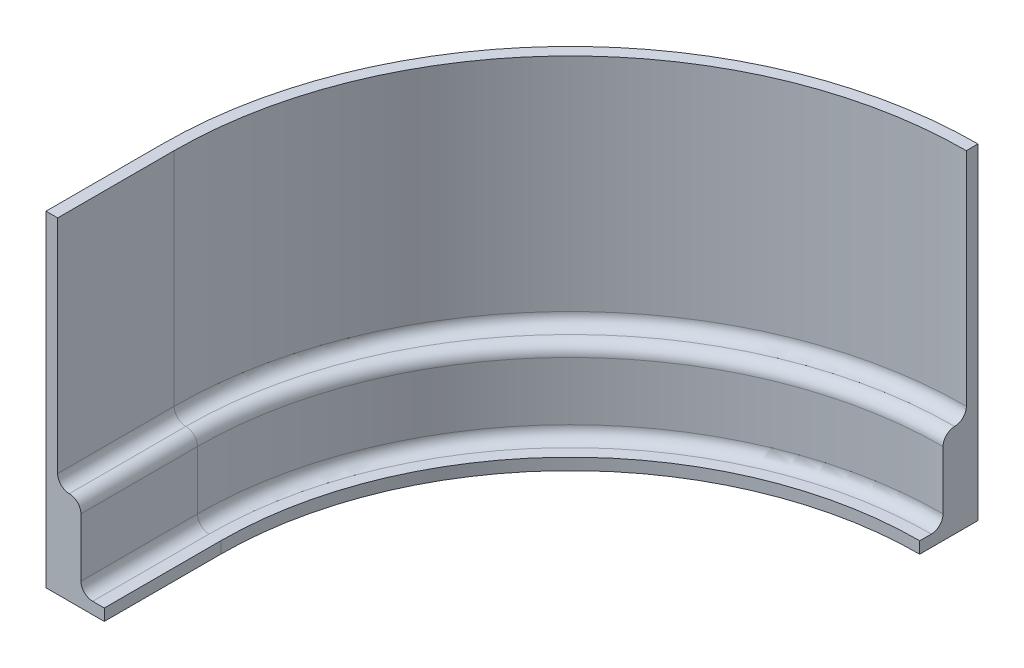
from build123d import *

# Parameters (mm, degrees)
BOTTOM_LEVEL_DEPTH = 5
MID_LEVEL_DEPTH    = 35
GUARD_RAIL_DEPTH   = 100
ROUNDING_R         = 5


with BuildPart() as part:
    # Sketch1 → Bottom level (new body)
    with BuildSketch(Plane(origin=(0, 0, 0), x_dir=(1, 0, 0), z_dir=(0, 1, 0))):
        with BuildLine():
            Line((150, 150), (150, 175))
            ThreePointArc((150, 175), (26.256313292, 123.743686708), (-25, 0))
            Line((-25, 0), (-25, -50))
            Line((-25, -50), (0, -50))
            Line((0, -50), (0, 0))
            ThreePointArc((0, 0), (43.933982822, 106.066017178), (150, 150))
        make_face()
    extrude(amount=BOTTOM_LEVEL_DEPTH)

    # Sketch2 → Mid level (add)
    with BuildSketch(Plane(origin=(0, 5, 0), x_dir=(1, 0, 0), z_dir=(0, 1, 0))):
        with BuildLine():
            Line((-25, 0), (-25, -50))
            Line((-25, -50), (-10, -50))
            Line((-10, -50), (-10, 0))
            ThreePointArc((-10, 0), (36.86291501, 113.13708499), (150, 160))
            Line((150, 160), (150, 175))
            ThreePointArc((150, 175), (26.256313292, 123.743686708), (-25, 0))
        make_face()
    extrude(amount=MID_LEVEL_DEPTH)

    # Sketch3 → Guard rail (add)
    with BuildSketch(Plane(origin=(0, 40, 0), x_dir=(1, 0, 0), z_dir=(0, 1, 0))):
        with BuildLine():
            Line((-25, 0), (-25, -50))
            Line((-25, -50), (-20, -50))
            Line((-20, -50), (-20, 0))
            ThreePointArc((-20, 0), (29.791847198, 120.208152802), (150, 170))
            Line((150, 170), (150, 175))
            ThreePointArc((150, 175), (26.256313292, 123.743686708), (-25, 0))
        make_face()
    extrude(amount=GUARD_RAIL_DEPTH)

    # Rounding
    rounding_edges = [part.edges().sort_by_distance(p)[0] for p in [
        (-10, 5, 25),
        (-10, 40, 25),
        (-20, 40, 25),
        (36.86291501, 5, -113.13708499),
        (36.86291501, 40, -113.13708499),
        (29.791847198, 40, -120.208152802),
    ]]
    fillet(rounding_edges, radius=ROUNDING_R - 0.0001)  # a hair under: the kernel refuses the full size


solid = part.part
